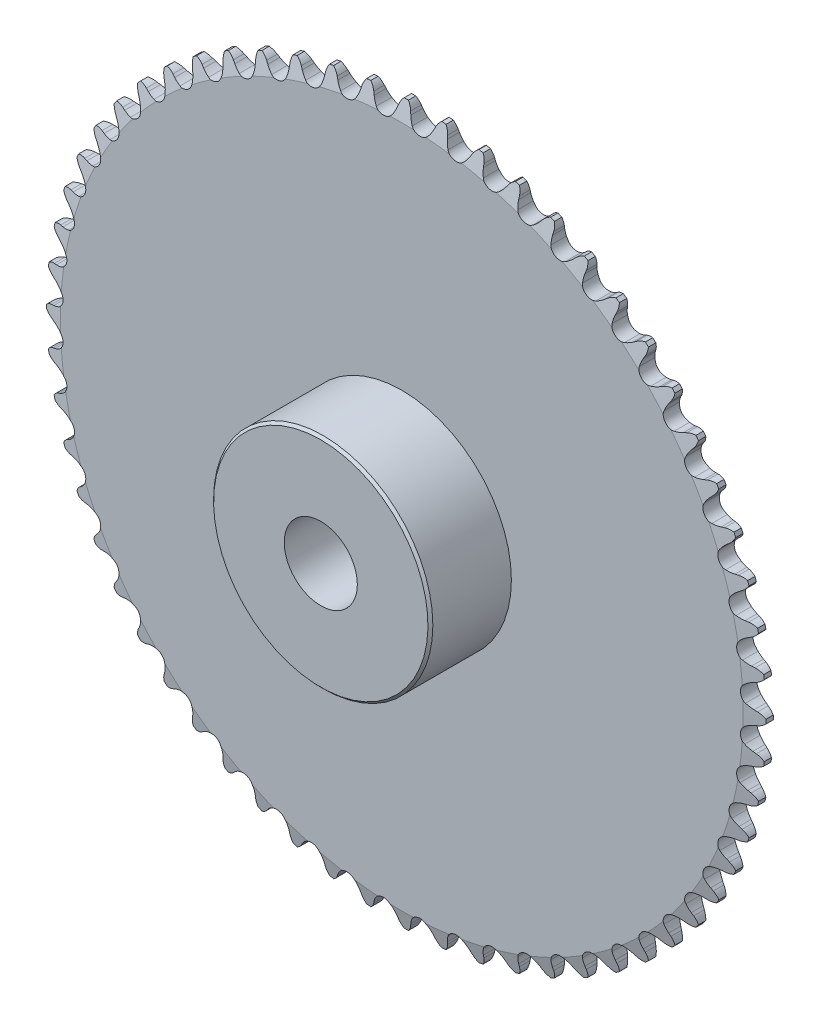
from build123d import *

# Parameters (mm, degrees)
CUT_EXTRUDE1_DEPTH      = 133.573611054
CIRPATTERN1_COUNT       = 60
BOSS_EXTRUDE1_START     = 2.1463
SKETCH2_R               = 28.575
BOSS_EXTRUDE1_DEPTH     = 21.1074
CUT_EXTRUDE2_DEPTH      = 135.580423336
CUT_EXTRUDE2_DEPTH_BACK = 135.580423336
SKETCH3_R               = 9.525
SKETCH4_W               = 3.21945
SKETCH4_H               = 8.001


with BuildPart() as part:
    # Sketch1 → Revolve1 (revolve)
    with BuildSketch(Plane(origin=(0, 0, 0), x_dir=(0, 0, -1), z_dir=(1, 0, 0)), mode=Mode.PRIVATE) as revolve1_sk:
        Polygon((2.1463, 0), (-2.1463, 0), (-2.1463, 88.968913475), (-0.955675, 93.731413475), (0.955675, 93.731413475), (2.1463, 88.968913475), align=None)
    revolve(revolve1_sk.sketch.rotate(Axis((0, 0, -2.1463), (0, 0, 1)), 90), axis=Axis((0, 0, -2.1463), (0, 0, 1)))

    # Sketch0 → Cut-Extrude1 (cut, symmetric)
    with BuildSketch(Plane.XY):
        with BuildLine():
            Line((8.061051224, -91.65039306), (7.777298409, -90.945720653))
            ThreePointArc((7.777298409, -90.945720653), (7.340112567, -90.057241706), (6.775929757, -89.243470206))
            ThreePointArc((6.775929757, -89.243470206), (4.626908005, -88.286664077), (2.589672293, -89.462862663))
            ThreePointArc((2.589672293, -89.462862663), (2.113642419, -90.3311494), (1.771722866, -91.260459531))
            Line((1.771722866, -91.260459531), (1.563182803, -91.990931914))
            ThreePointArc((1.563182803, -91.990931914), (0.0589948, -94.153542983), (-2.454667012, -94.941561052))
            ThreePointArc((-2.454667012, -94.941561052), (4.970517837, -94.84313026), (12.365315567, -94.164878676))
            ThreePointArc((12.365315567, -94.164878676), (9.783053539, -93.643926659), (8.061051224, -91.65039306))
        make_face()
    cut_extrude1 = extrude(amount=CUT_EXTRUDE1_DEPTH, both=True, mode=Mode.SUBTRACT)

    # CirPattern1: Cut-Extrude1 ×60 about axis
    cirpattern1_axis = Axis((0, 0, 0), (0, 0, 1))
    for i in range(1, CIRPATTERN1_COUNT):
        add(cut_extrude1.rotate(cirpattern1_axis, i * 360 / CIRPATTERN1_COUNT), mode=Mode.SUBTRACT)

    # Sketch2 → Boss-Extrude1 (add)
    with BuildSketch(Plane.XY.offset(BOSS_EXTRUDE1_START)):
        Circle(SKETCH2_R)
    extrude(amount=BOSS_EXTRUDE1_DEPTH)

    # Sketch3 → Cut-Extrude2 (cut, two sides: drawn at the far end of the back side and taken through both)
    with BuildSketch(Plane.XY.offset(-CUT_EXTRUDE2_DEPTH_BACK)):
        Circle(SKETCH3_R)
    extrude(amount=CUT_EXTRUDE2_DEPTH + CUT_EXTRUDE2_DEPTH_BACK, mode=Mode.SUBTRACT)

    # Sketch4 → Cut-Revolve1 (revolve, cut)
    with BuildSketch(Plane(origin=(0, 0, 0), x_dir=(0, 0, -1), z_dir=(1, 0, 0))):
        Polygon((-23.2537, 28.575), (-23.2537, 27.94), (-22.6187, 28.575), align=None)
        with Locations((-3.756025, 89.730913475)):
            Rectangle(SKETCH4_W, SKETCH4_H)
    revolve(axis=Axis((0, 0, -2.1463), (0, 0, 1)), mode=Mode.SUBTRACT)


solid = part.part
